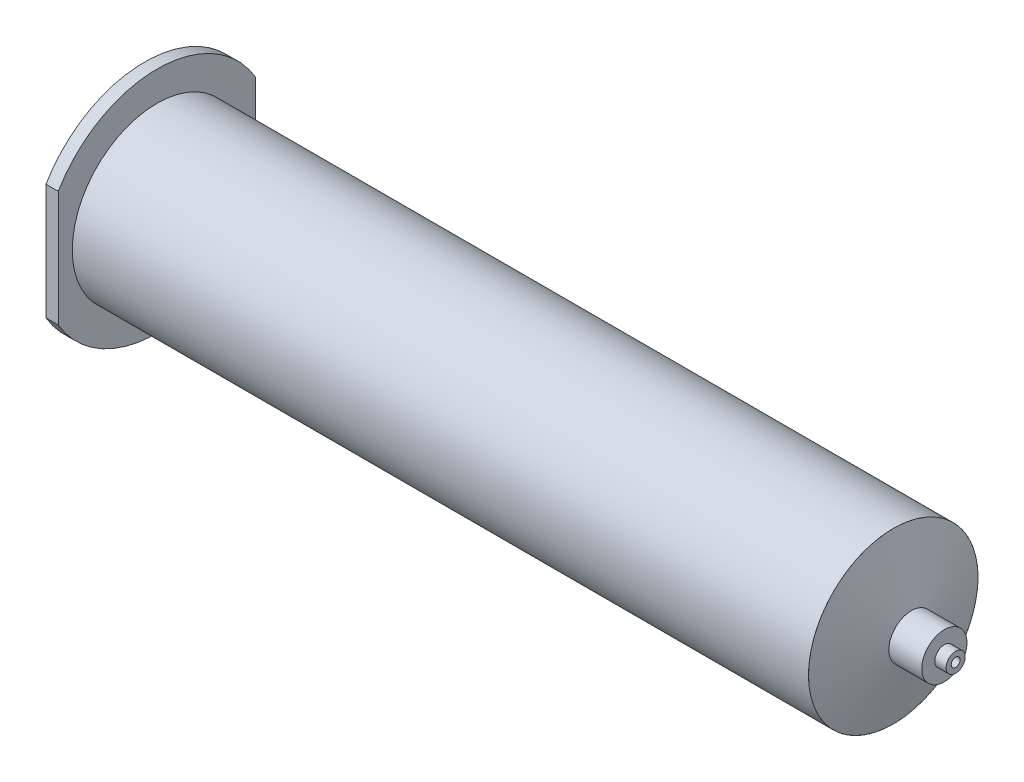
from build123d import *

# Parameters (mm, degrees)
REVOLVE1_START       = -2.3
REVOLVE1_OUTLINE_R   = 1.95
REVOLVE1_DEPTH       = 2.3
REVOLVE1_START_2     = -165.1
REVOLVE1_3_OUTLINE_R = 17.25
REVOLVE1_3_DEPTH     = 152.4
BOSS_EXTRUDE1_DEPTH  = 2.5
SKETCH8_W            = 12.7
SKETCH8_H            = 0.9


# Read off the part's stored shape, not the designer's step: Revolve1
with BuildPart() as part:
    # Revolve1 outline → Revolve1 (new body)
    with BuildSketch(Plane.YZ.offset(REVOLVE1_START)):
        with Locations((0, 17.25)):
            Circle(REVOLVE1_OUTLINE_R)
    extrude(amount=REVOLVE1_DEPTH)


with BuildPart() as body_2:
    # Revolve1 2 outline → Revolve1 2 (revolve)
    with BuildSketch(Plane.YX.offset(-17.25)):
        Polygon((1.95, -9), (0, -9), (0, -12.7), (17.25, -12.7), (4.6, -9), (4.6, -2.3), (1.95, -2.3), align=None)
    revolve(axis=Axis((0, 0, 17.25), (1, 0, 0)))


with BuildPart() as body_3:
    # Revolve1 3 outline → Revolve1 3 (new body)
    with BuildSketch(Plane.YZ.offset(REVOLVE1_START_2)):
        with Locations((0, 17.25)):
            Circle(REVOLVE1_3_OUTLINE_R)
    extrude(amount=REVOLVE1_3_DEPTH)

    # Sketch3 → Boss-Extrude1 (add)
    with BuildSketch(Plane.ZY.offset(165.1)):
        with BuildLine():
            ThreePointArc((37.35, 11.78473589), (17.25, 23.3), (-2.85, 11.78473589))
            Line((-2.85, 11.78473589), (4.653075772, 11.78473589))
            ThreePointArc((4.653075772, 11.78473589), (17.25, 17.25), (29.846924228, 11.78473589))
            Line((29.846924228, 11.78473589), (37.35, 11.78473589))
        make_face()
        with BuildLine():
            ThreePointArc((29.846924228, 11.78473589), (17.25, 17.25), (4.653075772, 11.78473589))
            Line((4.653075772, 11.78473589), (29.846924228, 11.78473589))
        make_face()
        with BuildLine():
            Line((29.846924228, 11.78473589), (4.653075772, 11.78473589))
            ThreePointArc((4.653075772, 11.78473589), (0, 0), (4.653075772, -11.78473589))
            Line((4.653075772, -11.78473589), (29.846924228, -11.78473589))
            ThreePointArc((29.846924228, -11.78473589), (33.294616588, -6.335043689), (34.5, 0))
            ThreePointArc((34.5, 0), (33.294616588, 6.335043689), (29.846924228, 11.78473589))
        make_face()
        with BuildLine():
            Line((4.653075772, 11.78473589), (-2.85, 11.78473589))
            Line((-2.85, 11.78473589), (-2.85, -11.78473589))
            Line((-2.85, -11.78473589), (4.653075772, -11.78473589))
            ThreePointArc((4.653075772, -11.78473589), (0, 0), (4.653075772, 11.78473589))
        make_face()
        with BuildLine():
            Line((4.653075772, -11.78473589), (-2.85, -11.78473589))
            ThreePointArc((-2.85, -11.78473589), (17.25, -23.3), (37.35, -11.78473589))
            Line((37.35, -11.78473589), (29.846924228, -11.78473589))
            ThreePointArc((29.846924228, -11.78473589), (17.25, -17.25), (4.653075772, -11.78473589))
        make_face()
        with BuildLine():
            Line((29.846924228, -11.78473589), (4.653075772, -11.78473589))
            ThreePointArc((4.653075772, -11.78473589), (17.25, -17.25), (29.846924228, -11.78473589))
        make_face()
        with BuildLine():
            Line((37.35, -11.78473589), (37.35, 11.78473589))
            Line((37.35, 11.78473589), (29.846924228, 11.78473589))
            ThreePointArc((29.846924228, 11.78473589), (33.294616588, 6.335043689), (34.5, 0))
            ThreePointArc((34.5, 0), (33.294616588, -6.335043689), (29.846924228, -11.78473589))
            Line((29.846924228, -11.78473589), (37.35, -11.78473589))
        make_face()
    extrude(amount=-BOSS_EXTRUDE1_DEPTH)


with BuildPart() as cut_revolve9_tool:
    # Sketch8 → Cut-Revolve9 (revolve)
    with BuildSketch(Plane(origin=(0, 0, 0), x_dir=(1, 0, 0), z_dir=(0, 1, 0))):
        Polygon((-165.1, -1.8), (-165.1, -17.25), (-12.7, -17.25), (-12.7, -16.35), (-12.7, -1.8), align=None)
        with Locations((-6.35, -16.8)):
            Rectangle(SKETCH8_W, SKETCH8_H)
    revolve(axis=Axis((-165.1, 0, 17.25), (1, 0, 0)))


with BuildPart() as part_1:
    add(part.part)

    # Cut-Revolve9: cut by cut_revolve9_tool
    add(cut_revolve9_tool.part, mode=Mode.SUBTRACT)


with BuildPart() as body_2_1:
    add(body_2.part)

    # Cut-Revolve9: cut by cut_revolve9_tool
    add(cut_revolve9_tool.part, mode=Mode.SUBTRACT)


with BuildPart() as body_3_1:
    add(body_3.part)

    # Cut-Revolve9: cut by cut_revolve9_tool
    add(cut_revolve9_tool.part, mode=Mode.SUBTRACT)


solid = Compound([part_1.part, body_2_1.part, body_3_1.part])
